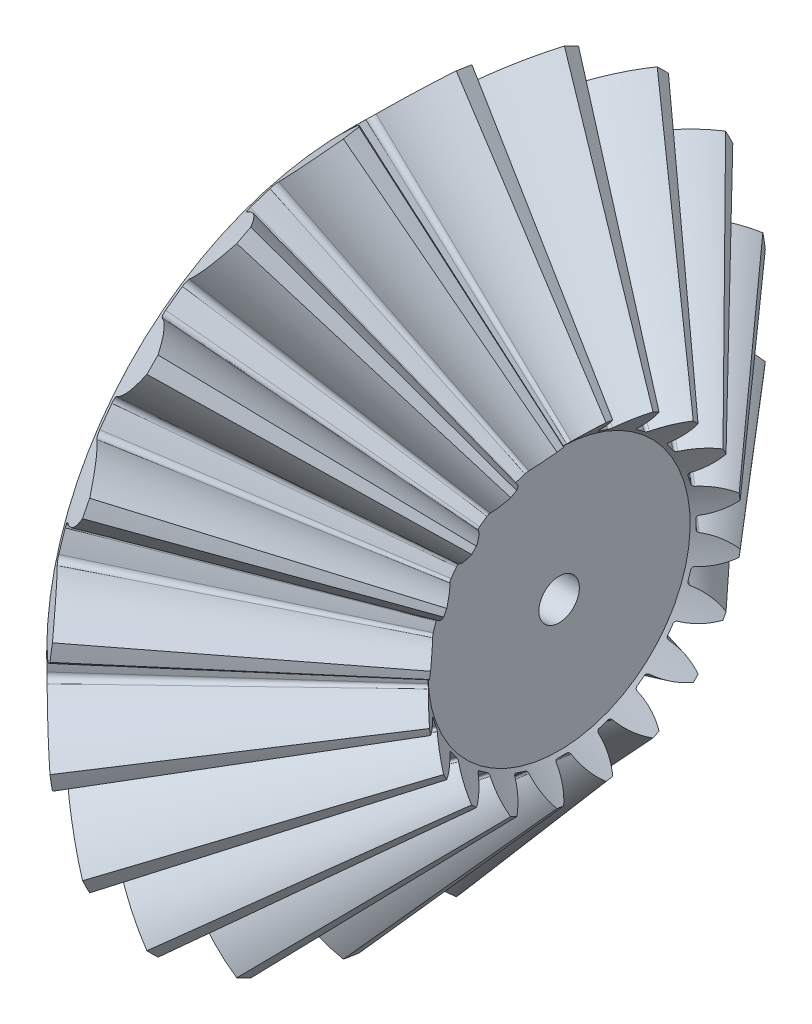
from build123d import *

# Parameters (mm, degrees)
TEETHCUTS_COUNT     = 20
TEETHCUTS_ANGLE     = 342
HUBSKE_R            = 8.949062546
HUB_DEPTH           = 0.0001016
BORSKE_R            = 0.4
BORE_DEPTH          = 11.050988254
SKETCH1_R           = 1.5
CUT_EXTRUDE2_DEPTH  = 17.254341912
SKETCH2_R           = 3
CUT_EXTRUDE3_DEPTH  = 3
SKETCH3_R           = 3
SKETCH3_R_2         = 0.6
BOSS_EXTRUDE1_DEPTH = 6.251455845


with BuildPart() as part:
    # BasProSke → Base-Revolve (revolve)
    with BuildSketch(Plane(origin=(0, 0, 0), x_dir=(1, 0, 0), z_dir=(0, 1, 0)), mode=Mode.PRIVATE) as base_revolve_sk:
        Polygon((0, 0), (0, 8.949062547), (1.758044236, 10.707106781), (7.01489848, 4.650252526), (6.251354245, 3.886708293), (6.251354245, 0), align=None)
    revolve(base_revolve_sk.sketch.rotate(Axis((-10, 0, 0), (1, 0, 0)), 180), axis=Axis((-10, 0, 0), (1, 0, 0)))

    # ToothCut: read off the stored shape, not the designer's step
    # ToothCut: loft between two sections, ruled curve by curve
    toothcut_from = [
        Edge.make_bspline([(11.056978059, 0.006040604, -0.009397446), (11.052757644, 0.001820189, -0.014823153), (11.047082221, -0.003855234, -0.014022361), (11.043703013, -0.007234441, -0.007524359)], [0, 0, 0, 0, 1, 1, 1, 1], 3, [1, 0.779680287, 0.779680287, 1]),
        Edge.make_bspline([(11.043703013, -0.007234441, 0.007524359), (11.047082221, -0.003855234, 0.014022361), (11.052757644, 0.001820189, 0.014823153), (11.056978059, 0.006040604, 0.009397446)], [0, 0, 0, 0, 1, 1, 1, 1], 3, [1, 0.779680287, 0.779680287, 1]),
        Edge.make_bspline([(11.043703013, -0.007234441, -0.007524359), (11.043200956, -0.007736499, -0.006558934), (11.042799872, -0.008137583, -0.005503268), (11.04250773, -0.008429724, -0.004378334)], [0, 0, 0, 0, 1, 1, 1, 1], 3, [1, 0.993377071, 0.993377071, 1]),
        Edge.make_bspline([(11.04250773, -0.008429724, 0.004378334), (11.042799872, -0.008137583, 0.005503268), (11.043200956, -0.007736499, 0.006558934), (11.043703013, -0.007234441, 0.007524359)], [0, 0, 0, 0, 1, 1, 1, 1], 3, [1, 0.993377071, 0.993377071, 1]),
        Edge.make_bspline([(11.04250773, -0.008429724, -0.004378334), (11.041765856, -0.009171599, -0.001521635), (11.041765856, -0.009171599, 0.001521635), (11.04250773, -0.008429724, 0.004378334)], [0, 0, 0, 0, 1, 1, 1, 1], 3, [1, 0.959129516, 0.959129516, 1]),
        Edge.make_line((11.056978059, 0.006040604, 0.009397446), (11.056978059, 0.006040604, -0.009397446)),
    ]
    toothcut_to = [
        Edge.make_bspline([(1.831702175, 10.780764719, -1.608058394), (1.416177176, 10.365239721, -1.022568098), (0.895186141, 9.844248687, -0.641441323), (0.317192874, 9.266255421, -0.500131372)], [0, 0, 0, 0, 1, 1, 1, 1], 3, [1, 0.968992554, 0.968992554, 1]),
        Edge.make_bspline([(0.317192874, 9.266255421, 0.500131372), (0.895186141, 9.844248687, 0.641441323), (1.416177176, 10.365239721, 1.022568098), (1.831702175, 10.780764719, 1.608058394)], [0, 0, 0, 0, 1, 1, 1, 1], 3, [1, 0.968992554, 0.968992554, 1]),
        Edge.make_bspline([(0.317192874, 9.266255421, -0.500131372), (0.248143517, 9.197206064, -0.483249928), (0.20395306, 9.153015607, -0.406340777), (0.206397022, 9.155459569, -0.307302074)], [0, 0, 0, 0, 1, 1, 1, 1], 3, [1, 0.835744927, 0.835744927, 1]),
        Edge.make_bspline([(0.206397022, 9.155459569, 0.307302074), (0.20395306, 9.153015607, 0.406340777), (0.248143517, 9.197206064, 0.483249928), (0.317192874, 9.266255421, 0.500131372)], [0, 0, 0, 0, 1, 1, 1, 1], 3, [1, 0.835744927, 0.835744927, 1]),
        Edge.make_bspline([(0.206397022, 9.155459569, -0.307302074), (0.211451493, 9.16051404, -0.102475588), (0.211451493, 9.16051404, 0.102475588), (0.206397022, 9.155459569, 0.307302074)], [0, 0, 0, 0, 1, 1, 1, 1], 3, [1, 0.999594406, 0.999594406, 1]),
        Edge.make_line((1.831702175, 10.780764719, 1.608058394), (1.831702175, 10.780764719, -1.608058394)),
    ]
    toothcut = Solid(Shell([*[Face.make_surface_from_curves(toothcut_from[k], toothcut_to[k]) for k in range(6)], Face(Wire(toothcut_from)), Face(Wire(toothcut_to))]))
    add(toothcut, mode=Mode.SUBTRACT)

    # TeethCuts: ToothCut ×20 about axis
    teethcuts_axis = Axis((-10, 0, 0), (1, 0, 0))
    for i in range(1, TEETHCUTS_COUNT):
        add(toothcut.rotate(teethcuts_axis, i * TEETHCUTS_ANGLE / (TEETHCUTS_COUNT - 1)), mode=Mode.SUBTRACT)

    # HubSke → Hub (add)
    with BuildSketch(Plane.ZY):
        Circle(HUBSKE_R)
    extrude(amount=HUB_DEPTH)

    # BorSke → Bore (cut, symmetric)
    with BuildSketch(Plane(origin=(0, 0, 0), x_dir=(0, 0, -1), z_dir=(1, 0, 0))):
        with Locations(Location((0, 0, 0), (0, 0, 180))):
            Circle(BORSKE_R)
    extrude(amount=BORE_DEPTH, both=True, mode=Mode.SUBTRACT)

    # Sketch1 → Cut-Extrude2 (cut, through all)
    with BuildSketch(Plane(origin=(6.251354245, 0, 0), x_dir=(0, 0, -1), z_dir=(1, 0, 0))):
        Circle(SKETCH1_R)
    extrude(amount=-CUT_EXTRUDE2_DEPTH, mode=Mode.SUBTRACT)

    # Sketch2 → Cut-Extrude3 (cut)
    with BuildSketch(Plane(origin=(6.251354245, 0, 0), x_dir=(0, 0, -1), z_dir=(1, 0, 0))):
        Circle(SKETCH2_R)
    extrude(amount=-CUT_EXTRUDE3_DEPTH, mode=Mode.SUBTRACT)

    # Sketch3 → Boss-Extrude1 (add)
    with BuildSketch(Plane(origin=(6.251354245, 0, 0), x_dir=(0, 0, -1), z_dir=(1, 0, 0))):
        Circle(SKETCH3_R)
        Circle(SKETCH3_R_2, mode=Mode.SUBTRACT)
    extrude(amount=-BOSS_EXTRUDE1_DEPTH)


solid = part.part
